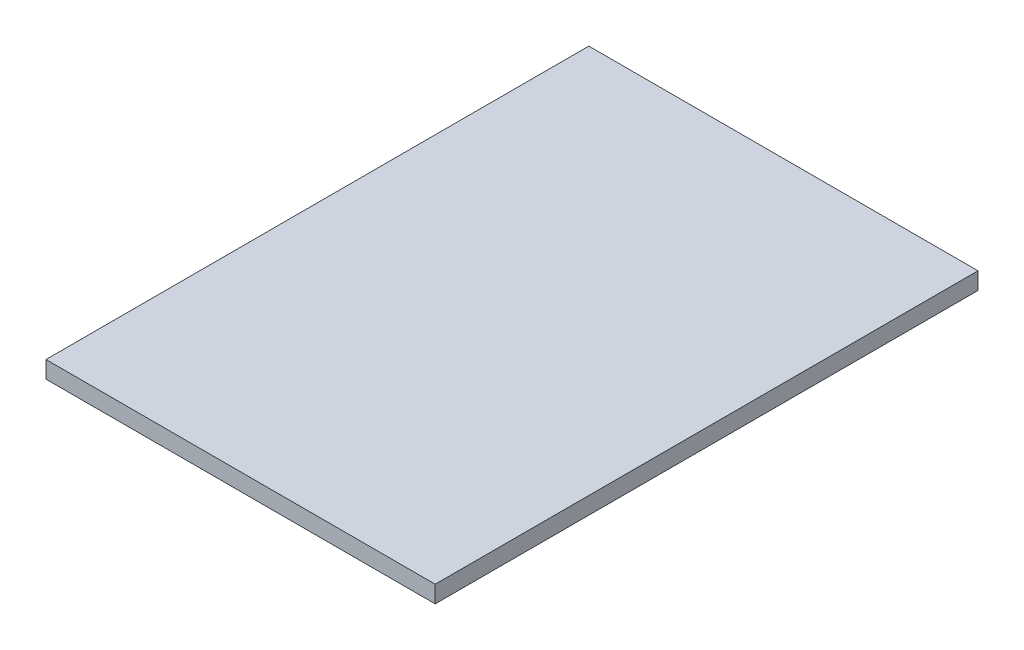
from build123d import *

# Parameters (mm, degrees)
SKETCH1_W           = 57.912
SKETCH1_H           = 80.772
BOSS_EXTRUDE1_DEPTH = 2.54


with BuildPart() as part:
    # Sketch1 → Boss-Extrude1 (new body)
    with BuildSketch(Plane(origin=(0, 0, 0), x_dir=(1, 0, 0), z_dir=(0, 1, 0))):
        Rectangle(SKETCH1_W, SKETCH1_H)
    extrude(amount=BOSS_EXTRUDE1_DEPTH)


solid = part.part
